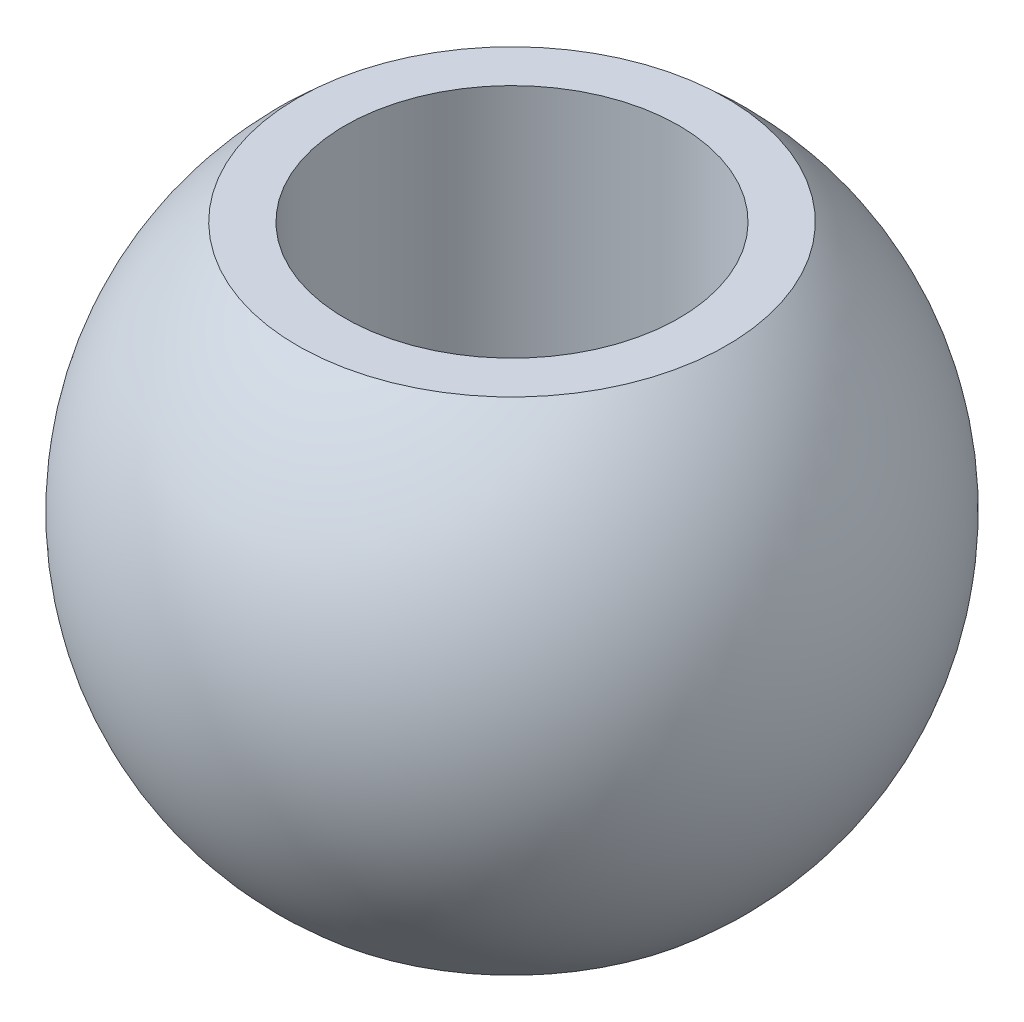
from build123d import *


with BuildPart() as part:
    # Szkic1 → Obrót1 (revolve)
    with BuildSketch(Plane.XY):
        with BuildLine():
            Line((-5.139066063, 6), (-4, 6))
            Line((-4, 6), (-4, -6))
            Line((-4, -6), (-5.139066063, -6))
            ThreePointArc((-5.139066063, -6), (-7.9, 0), (-5.139066063, 6))
        make_face()
    revolve(axis=Axis((0, 0, 0), (0, 1, 0)))


solid = part.part
